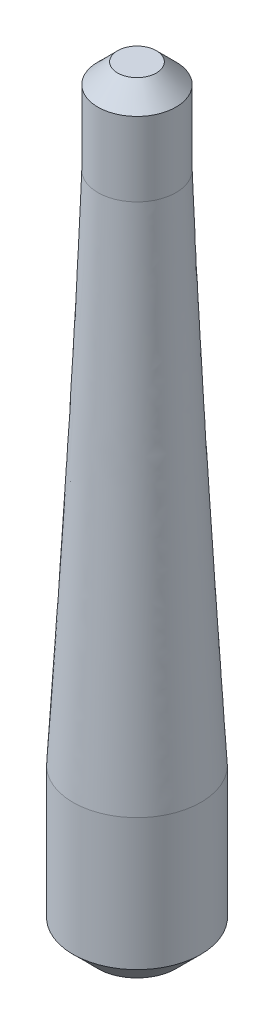
from build123d import *

# Parameters (mm, degrees)
SKETCH3_R           = 2.6
BOSS_EXTRUDE1_DEPTH = 6.35
SKETCH4_R           = 1.5875
BOSS_EXTRUDE2_DEPTH = 3.81
CHAMFER5_SIZE       = 1
CHAMFER6_SIZE       = 0.8


with BuildPart() as part:
    # Loft1: read off the stored shape, not the designer's step
    # Loft1: loft between two sections, ruled curve by curve
    loft1_from = [
        Edge.make_bspline([(-0.37738018, 20.955, 1.541992364), (-3.461364907, 20.955, 0.787232004), (-2.706604547, 20.955, -2.296752724), (0.37738018, 20.955, -1.541992364), (3.461364907, 20.955, -0.787232004), (2.706604547, 20.955, 2.296752724), (-0.37738018, 20.955, 1.541992364)], [0, 0, 0, 0, 0.5, 0.5, 0.5, 1, 1, 1, 1], 3, [1, 0.333333333, 0.333333333, 1, 0.333333333, 0.333333333, 1]),
    ]
    loft1_to = [
        Edge.make_bspline([(-1.759476646, 0, 1.914220972), (-5.587918591, 0, -1.60473232), (-2.068965299, 0, -5.433174265), (1.759476646, 0, -1.914220972), (5.587918591, 0, 1.60473232), (2.068965299, 0, 5.433174265), (-1.759476646, 0, 1.914220972)], [0, 0, 0, 0, 0.5, 0.5, 0.5, 1, 1, 1, 1], 3, [1, 0.333333333, 0.333333333, 1, 0.333333333, 0.333333333, 1]),
    ]
    loft1 = Solid(Shell([*[Face.make_surface_from_curves(loft1_from[k], loft1_to[k]) for k in range(1)], Face(Wire(loft1_from)), Face(Wire(loft1_to))]))
    add(loft1)

    # Sketch3 → Boss-Extrude1 (add)
    with BuildSketch(Plane.XZ):
        with Locations(Location((0, 0, 0), (0, 0, 132.588))):
            Circle(SKETCH3_R)
    extrude(amount=BOSS_EXTRUDE1_DEPTH)

    # Sketch4 → Boss-Extrude2 (add)
    with BuildSketch(Plane(origin=(0, 20.955, 0), x_dir=(1, 0, 0), z_dir=(0, 1, 0))):
        with Locations(Location((0, 0, 0), (0, 0, 256.248))):
            Circle(SKETCH4_R)
    extrude(amount=BOSS_EXTRUDE2_DEPTH)

    # Chamfer5
    chamfer5_edges = [part.edges().sort_by_distance(p)[0] for p in [
        (1.759476646, -6.35, -1.914220972),
    ]]
    chamfer(chamfer5_edges, length=CHAMFER5_SIZE)

    # Chamfer6
    chamfer6_edges = [part.edges().sort_by_distance(p)[0] for p in [
        (0.37738018, 24.765, -1.541992364),
    ]]
    chamfer(chamfer6_edges, length=CHAMFER6_SIZE)


solid = part.part
